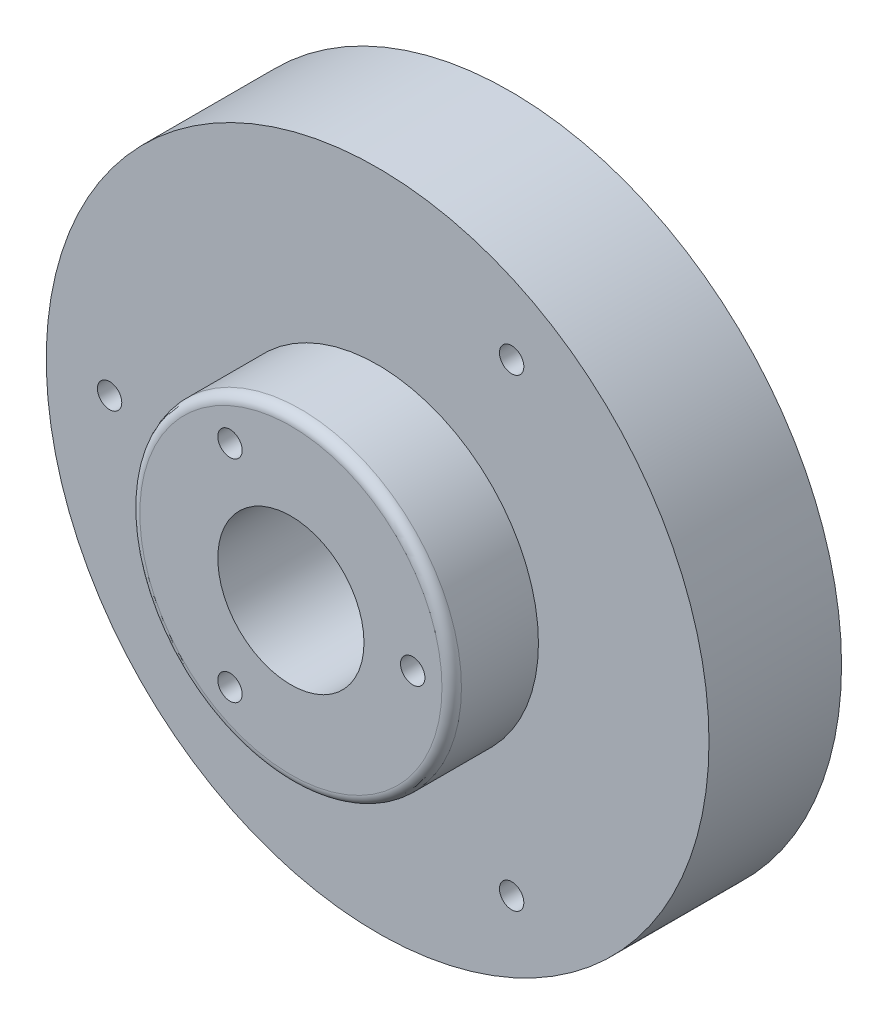
from build123d import *

# Parameters (mm, degrees)
SKETCH_1_R          = 34
EXTRUDE_1_DEPTH     = 13.6
SKETCH_2_R          = 16.5
EXTRUDE_2_DEPTH     = 8.9
FILLET_1_R          = 1
SKETCH_3_R          = 4
CUT_EXTRUDE_1_DEPTH = 54.087192429
SKETCH_4_R          = 7.5
CUT_EXTRUDE_2_DEPTH = 54.087192429
M3X0_52_D           = 2.5
M3X0_53_D           = 2.5


with BuildPart() as part:
    # Эскиз1 → Бобышка-Вытянуть1 (new body)
    with BuildSketch(Plane.XY):
        Circle(SKETCH_1_R)
    extrude(amount=EXTRUDE_1_DEPTH)

    # Эскиз2 → Бобышка-Вытянуть2 (add)
    with BuildSketch(Plane.XY.offset(13.6)):
        Circle(SKETCH_2_R)
    extrude(amount=EXTRUDE_2_DEPTH)

    # Скругление1
    fillet_1_edges = [part.edges().sort_by_distance(p)[0] for p in [
        (-16.5, 0, 22.5),
    ]]
    fillet(fillet_1_edges, radius=FILLET_1_R)

    # Эскиз3 → Вырез-Вытянуть1 (cut, through all)
    with BuildSketch(Plane(origin=(0, 0, 0), x_dir=(-1, 0, 0), z_dir=(0, 0, -1))):
        Circle(SKETCH_3_R)
    extrude(amount=-CUT_EXTRUDE_1_DEPTH, mode=Mode.SUBTRACT)

    # Эскиз4 → Вырез-Вытянуть2 (cut, through all)
    with BuildSketch(Plane.XY.offset(22.5)):
        Circle(SKETCH_4_R)
    extrude(amount=-CUT_EXTRUDE_2_DEPTH, mode=Mode.SUBTRACT)

    # Отверстие обработанное метчиком M3x0.52 (through all)
    with Locations(Plane.XY.offset(22.5)):
        with Locations((-6.25, 10.825317547), (-6.25, -10.825317547), (12.5, 0)):
            Hole(M3X0_52_D / 2)

    # Отверстие обработанное метчиком M3x0.53 (through all)
    with Locations(Plane.XY.offset(13.6)):
        with Locations((13.75, 23.815698604), (-27.5, 0), (13.75, -23.815698604)):
            Hole(M3X0_53_D / 2)


solid = part.part
